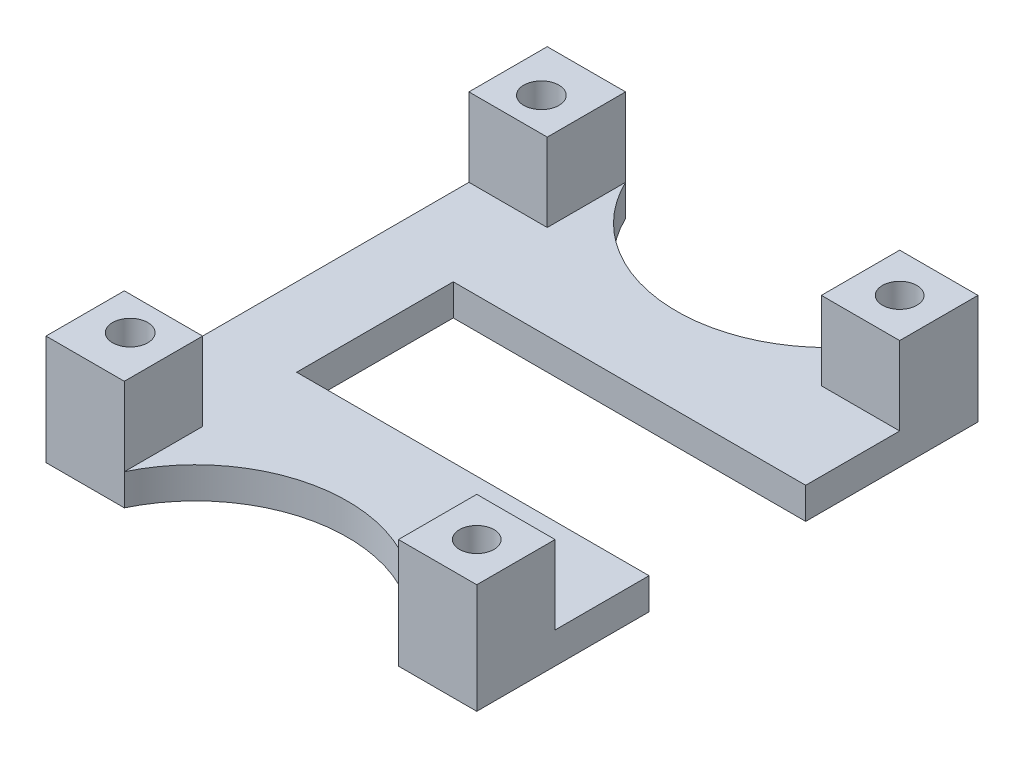
from build123d import *

# Parameters (mm, degrees)
SKETCH1_R                  = 2.2
SKETCH1_R_2                = 2.2479
EXTRUDE_BODY_DEPTH         = 4
SKETCH5_W                  = 10
SKETCH5_H                  = 10
SKETCH5_R                  = 2.2
SKETCH5_R_2                = 2.2479
EXTRUDE_LEGS_DEPTH         = 10
SKETCH6_R                  = 4.215
CUT_BOLT_HEAD_INSETS_DEPTH = 2.5


with BuildPart() as part:
    # Sketch1 → Extrude-Body (new body)
    with BuildSketch(Plane(origin=(0, 0, 0), x_dir=(1, 0, 0), z_dir=(0, 1, 0))):
        with BuildLine():
            Line((10, -10), (10, 10))
            Line((10, 10), (55, 10))
            Line((55, 10), (55, 32))
            Line((55, 32), (45, 32))
            ThreePointArc((45, 32), (27.5, 21), (10, 32))
            Line((10, 32), (0, 32))
            Line((0, 32), (0, -32))
            Line((0, -32), (10, -32))
            ThreePointArc((10, -32), (27.5, -21), (45, -32))
            Line((45, -32), (55, -32))
            Line((55, -32), (55, -10))
            Line((55, -10), (10, -10))
        make_face()
        with Locations((50, -27)):
            Circle(SKETCH1_R, mode=Mode.SUBTRACT)
        with Locations((5, -26.25)):
            Circle(SKETCH1_R_2, mode=Mode.SUBTRACT)
        with Locations((50, 27)):
            Circle(SKETCH1_R, mode=Mode.SUBTRACT)
        with Locations((5, 26.25)):
            Circle(SKETCH1_R_2, mode=Mode.SUBTRACT)
    extrude(amount=EXTRUDE_BODY_DEPTH)

    # Sketch5 → Extrude-Legs (add)
    # profile 1 of 4: a face of its own
    with BuildSketch(Plane(origin=(0, 4, 0), x_dir=(1, 0, 0), z_dir=(0, 1, 0))):
        with Locations((50, -27)):
            Rectangle(SKETCH5_W, SKETCH5_H)
        with Locations((50, -27)):
            Circle(SKETCH5_R, mode=Mode.SUBTRACT)
    # profile 2 of 4: a face of its own
    with BuildSketch(Plane(origin=(0, 4, 0), x_dir=(1, 0, 0), z_dir=(0, 1, 0))):
        with Locations((50, 27)):
            Rectangle(SKETCH5_W, SKETCH5_H)
        with Locations((50, 27)):
            Circle(SKETCH5_R, mode=Mode.SUBTRACT)
    # profile 3 of 4: a face of its own
    with BuildSketch(Plane(origin=(0, 4, 0), x_dir=(1, 0, 0), z_dir=(0, 1, 0))):
        with Locations((5, 27)):
            Rectangle(SKETCH5_W, SKETCH5_H)
        with Locations((5, 26.25)):
            Circle(SKETCH5_R_2, mode=Mode.SUBTRACT)
    # profile 4 of 4: a face of its own
    with BuildSketch(Plane(origin=(0, 4, 0), x_dir=(1, 0, 0), z_dir=(0, 1, 0))):
        with Locations((5, -27)):
            Rectangle(SKETCH5_W, SKETCH5_H)
        with Locations((5, -26.25)):
            Circle(SKETCH5_R_2, mode=Mode.SUBTRACT)
    extrude(amount=EXTRUDE_LEGS_DEPTH)

    # Sketch6 → Cut-Bolt Head Insets (cut)
    with BuildSketch(Plane.XZ):
        with Locations((50, 27)):
            Circle(SKETCH6_R)
        with Locations((50, -27)):
            Circle(SKETCH6_R)
    extrude(amount=-CUT_BOLT_HEAD_INSETS_DEPTH, mode=Mode.SUBTRACT)


solid = part.part
